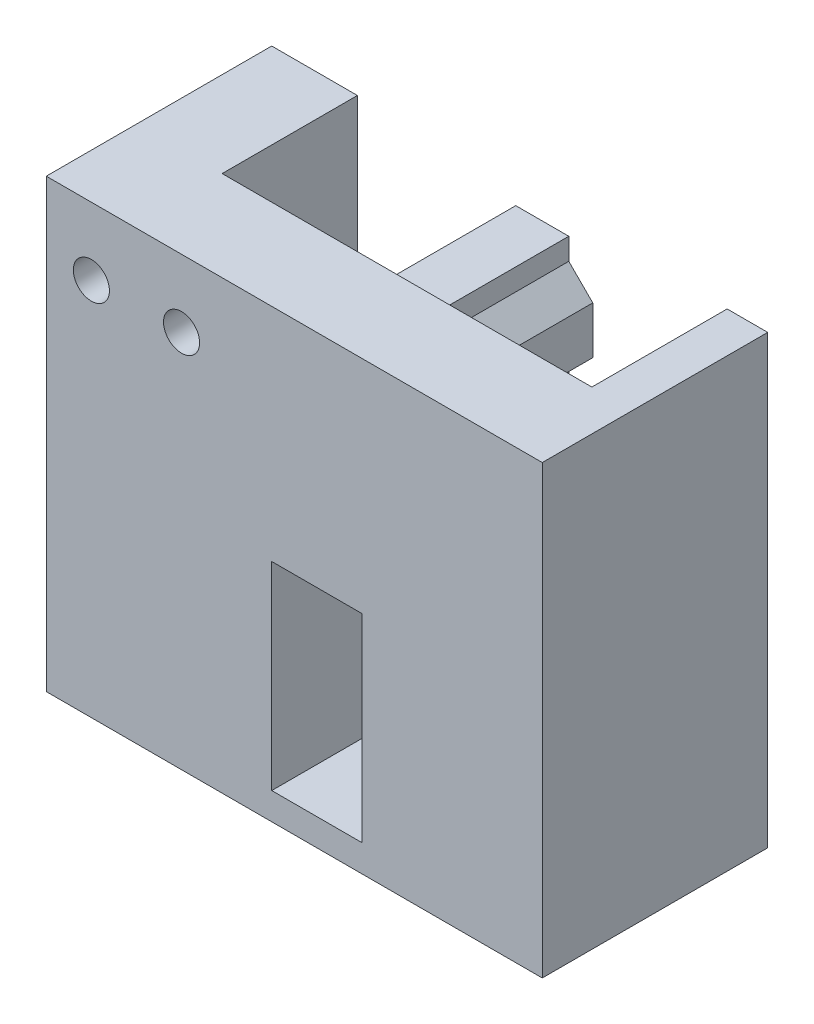
from build123d import *

# Parameters (mm, degrees)
BOSS_EXTRUDE1_DEPTH = 15
SKETCH3_W           = 55
SKETCH3_H           = 49.5
BOSS_EXTRUDE2_DEPTH = 10
BOSS_EXTRUDE3_DEPTH = 15
SKETCH5_R           = 2
CUT_EXTRUDE1_DEPTH  = 7
SKETCH6_R           = 2
CUT_EXTRUDE2_DEPTH  = 7
SKETCH7_W           = 10
SKETCH7_H           = 22
CUT_EXTRUDE3_DEPTH  = 43


with BuildPart() as part:
    # Sketch1 → Boss-Extrude1 (new body)
    with BuildSketch(Plane.XY):
        Polygon((15, -20), (-40, -20), (-40, 29.5), (-30.5, 29.5), (-30.5, 10), (-30.5, 3.494427191), (-29.7, 2.6), (-27.7, 2.6), (-27.7, 5), (-26.767766953, 5), (-24.4, 2.632233047), (-24.4, -2.783060843), (-26.767766953, -5), (-27.7, -5), (-27.7, -2.6), (-29.7, -2.6), (-30.5, -3.494427191), (-30.5, -10.5), (10.5, -10.5), (10.5, -3.494427191), (9.7, -2.6), (7.7, -2.6), (7.7, -5), (6.767766953, -5), (4.4, -2.783060843), (4.4, 2.632233047), (6.767766953, 5), (7.7, 5), (7.7, 2.6), (9.7, 2.6), (10.5, 3.494427191), (10.5, 10), (10.5, 29.5), (15, 29.5), align=None)
    extrude(amount=-BOSS_EXTRUDE1_DEPTH)

    # Sketch3 → Boss-Extrude2 (add)
    with BuildSketch(Plane.XY):
        with Locations((-12.5, 4.75)):
            Rectangle(SKETCH3_W, SKETCH3_H)
    extrude(amount=BOSS_EXTRUDE2_DEPTH)

    # Sketch5 → Cut-Extrude1 (cut)
    with BuildSketch(Plane.XY.offset(10)):
        with Locations((-35, 22)):
            Circle(SKETCH5_R)
        with Locations((-25, 22)):
            Circle(SKETCH5_R)
    extrude(amount=-CUT_EXTRUDE1_DEPTH, mode=Mode.SUBTRACT)

    # Sketch6 → Cut-Extrude2 (cut)
    with BuildSketch(Plane(origin=(0, -20, 0), x_dir=(-1, 0, 0), z_dir=(0, -1, 0))):
        with Locations((35, -1)):
            Circle(SKETCH6_R)
        with Locations((25, -1)):
            Circle(SKETCH6_R)
    extrude(amount=-CUT_EXTRUDE2_DEPTH, mode=Mode.SUBTRACT)

    # Sketch7 → Cut-Extrude3 (cut)
    with BuildSketch(Plane.XY.offset(10)):
        with Locations((-10, -6)):
            Rectangle(SKETCH7_W, SKETCH7_H)
    extrude(amount=-CUT_EXTRUDE3_DEPTH, mode=Mode.SUBTRACT)


with BuildPart() as body_2:
    # Sketch4 → Boss-Extrude3 (new body)
    with BuildSketch(Plane(origin=(0, 0, 0), x_dir=(-1, 0, 0), z_dir=(0, 0, -1))):
        Polygon((12.939339828, 25.292893219), (15.6, 22.632233047), (15.6, 17.367766953), (12.939339828, 14.707106781), (12.939339828, 12.3), (7.060660172, 12.3), (7.060660172, 14.707106781), (4.4, 17.367766953), (4.4, 22.632233047), (7.060660172, 25.292893219), (7.060660172, 27.7), (12.939339828, 27.7), align=None)
    extrude(amount=BOSS_EXTRUDE3_DEPTH)


solid = Compound([part.part, body_2.part])
